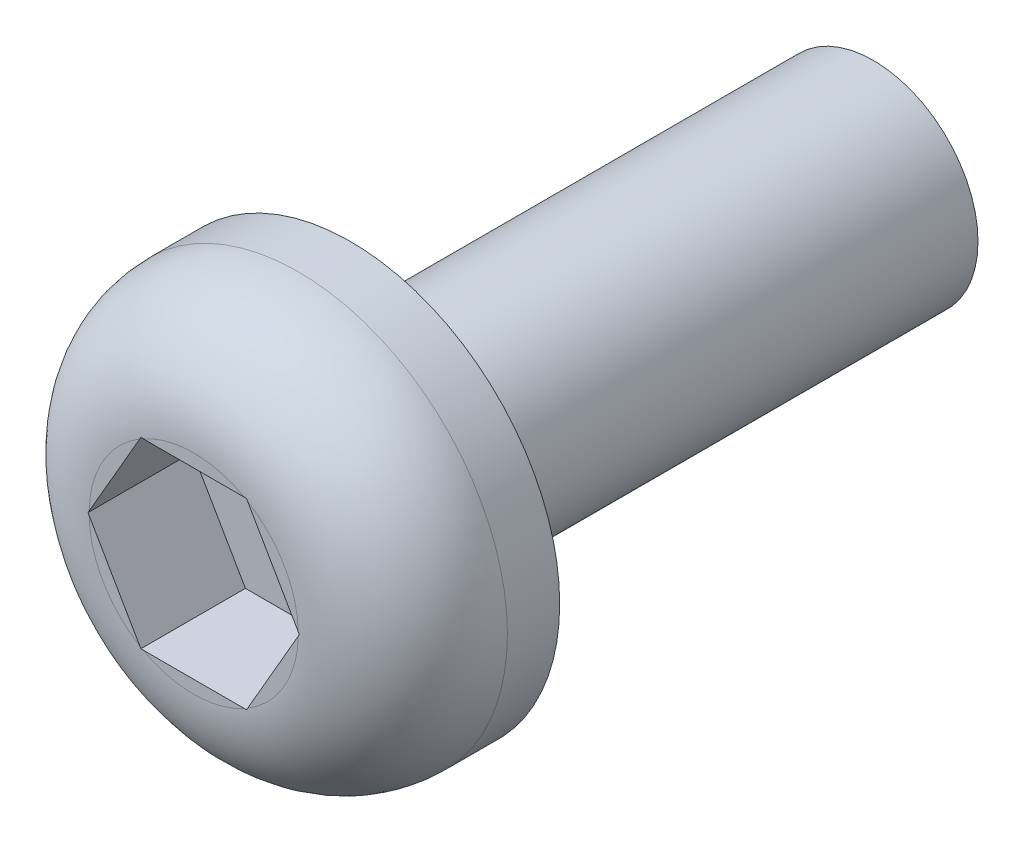
from build123d import *

# Parameters (mm, degrees)
SKETCH_1_R          = 2
EXTRUDE_1_DEPTH     = 10
SKETCH_2_R          = 4
EXTRUDE_2_DEPTH     = 3
CUT_EXTRUDE_1_DEPTH = 2
FILLET_1_R          = 2


with BuildPart() as part:
    # 草图1 → 凸台-拉伸1 (new body)
    with BuildSketch(Plane.XY):
        Circle(SKETCH_1_R)
    extrude(amount=EXTRUDE_1_DEPTH)

    # 草图2 → 凸台-拉伸2 (add)
    with BuildSketch(Plane.XY.offset(10)):
        Circle(SKETCH_2_R)
    extrude(amount=EXTRUDE_2_DEPTH)

    # 草图3 → 切除-拉伸1 (cut)
    with BuildSketch(Plane.XY.offset(13)):
        Polygon((2.020725942, 0), (1.010362971, 1.75), (-1.010362971, 1.75), (-2.020725942, 0), (-1.010362971, -1.75), (1.010362971, -1.75), align=None)
    extrude(amount=-CUT_EXTRUDE_1_DEPTH, mode=Mode.SUBTRACT)

    # 圆角1
    # the kernel refuses this fillet: 2 mm, written as the material it takes off along each edge
    with BuildSketch(Plane(origin=(0, 0, 13), x_dir=(1, 0, 0), z_dir=(0, -1, 0))) as fillet_1_piece_1:
        with BuildLine():
            CenterArc((4 - FILLET_1_R, -FILLET_1_R), FILLET_1_R, 0, 90)
            Line((4 - FILLET_1_R, 0), (4, 0))
            Line((4, 0), (4, -FILLET_1_R))
        make_face()
    revolve(axis=Axis((0, 0, 13), (0, 0, 1)), mode=Mode.SUBTRACT)


solid = part.part
